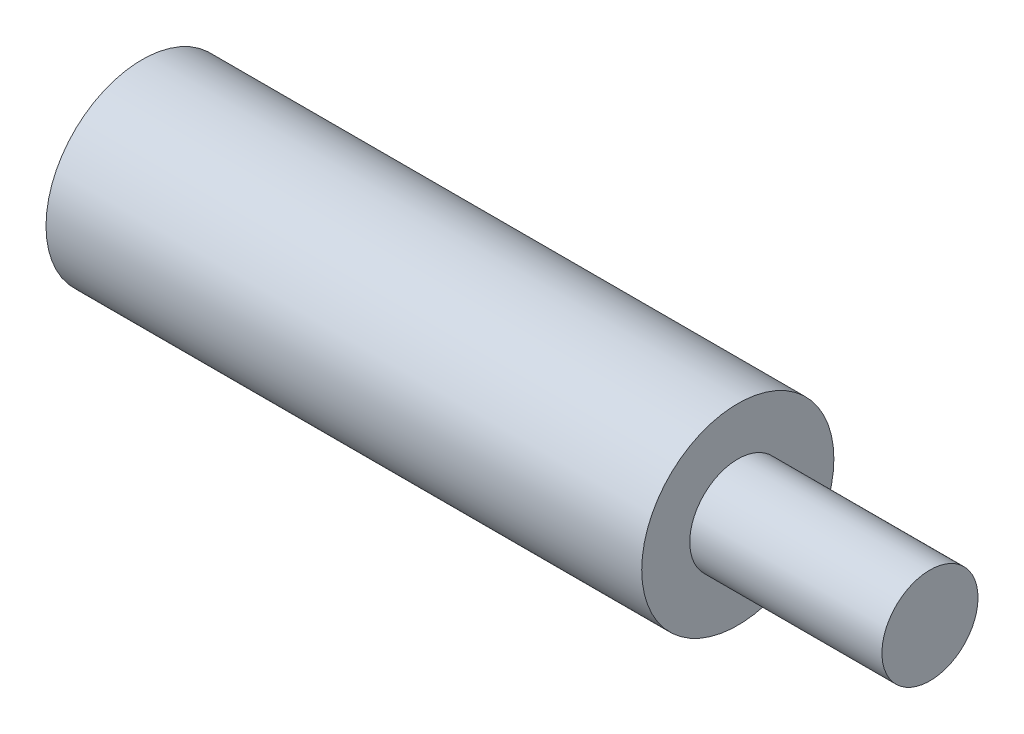
from build123d import *

# Parameters (mm, degrees)
M3_GEWINDEBOHRUNG1_D     = 2.5
M3_GEWINDEBOHRUNG1_DEPTH = 5
M3_GEWINDEBOHRUNG1_TIP   = 0.751075774


with BuildPart() as part:
    # Skizze1 → Rotation1 (revolve)
    with BuildSketch(Plane.XY):
        Polygon((0, 3), (18.6, 3), (18.6, 1.5), (24.6, 1.5), (24.6, 0), (0, 0), align=None)
    revolve(axis=Axis((24.6, 0, 0), (-1, 0, 0)))

    # M3 Gewindebohrung1
    with Locations(Plane.ZY):
        with Locations((0, 0)):
            Hole(M3_GEWINDEBOHRUNG1_D / 2, depth=M3_GEWINDEBOHRUNG1_DEPTH)
            with Locations((0, 0, -(M3_GEWINDEBOHRUNG1_DEPTH + M3_GEWINDEBOHRUNG1_TIP / 2))):  # 118° drill point
                Cone(0, M3_GEWINDEBOHRUNG1_D / 2, M3_GEWINDEBOHRUNG1_TIP, mode=Mode.SUBTRACT)


solid = part.part
